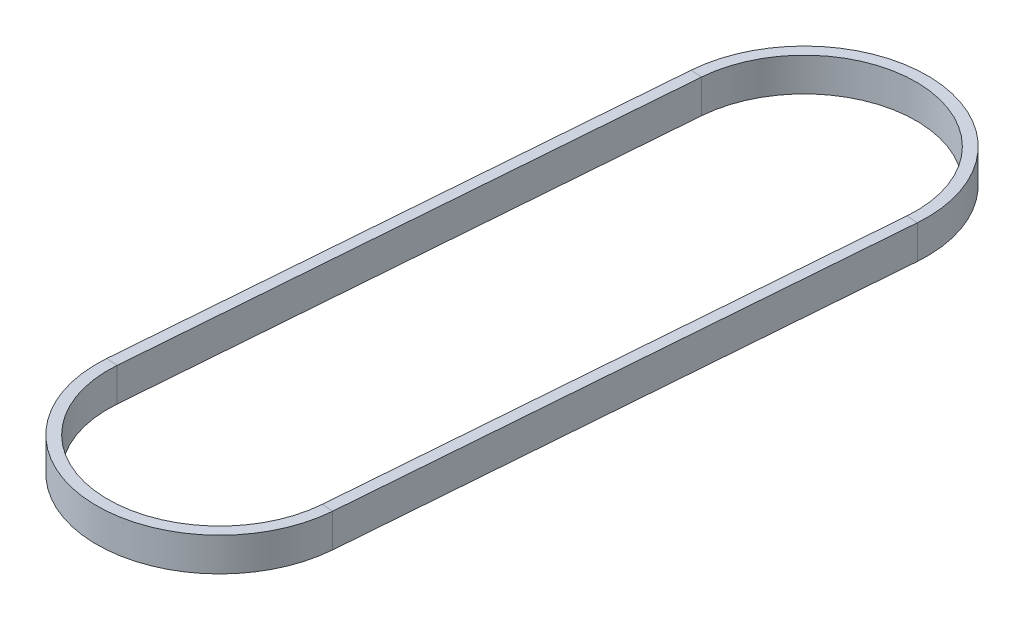
from build123d import *

# Parameters (mm, degrees)
SKETCH2_W = 2
SKETCH2_H = 6


with BuildPart() as part:
    # Sweep1: sweep along a path in Sketch1
    with BuildLine(Plane(origin=(0, 0, 0), x_dir=(1, 0, 0), z_dir=(0, 1, 0))) as sweep1_path:
        Line((781.796127092, -229.411285301), (774.190631347, -326.360584431))
        ThreePointArc((774.190631347, -326.360584431), (751.612587034, -345.653897132), (732.319274332, -323.075852819))
        Line((732.319274332, -323.075852819), (739.924770078, -226.126553689))
        ThreePointArc((739.924770078, -226.126553689), (762.502814391, -206.833240988), (781.796127092, -229.411285301))
    # Sketch2 → Sweep1 (sweep)
    with BuildSketch(Plane(origin=(739.924770078, 0, 226.126553689), x_dir=(-0.9969370717739422, 0, -0.07820789552722715), z_dir=(0.07820789552722715, 0, -0.9969370717739422))):
        Rectangle(SKETCH2_W, SKETCH2_H)
    sweep(path=sweep1_path.line)


solid = part.part
